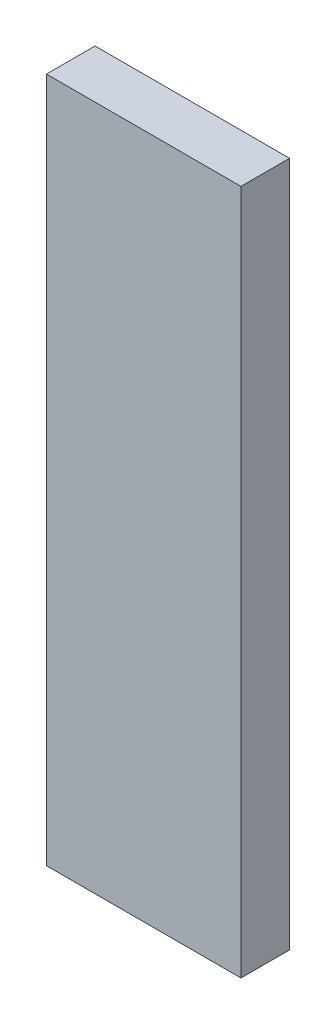
from build123d import *

# Parameters (mm, degrees)
SKETCH1_W           = 20
SKETCH1_H           = 70.5
BOSS_EXTRUDE1_DEPTH = 5


with BuildPart() as part:
    # Sketch1 → Boss-Extrude1 (new body)
    with BuildSketch(Plane.XY):
        with Locations((-90, 13.257283518)):
            Rectangle(SKETCH1_W, SKETCH1_H)
    extrude(amount=BOSS_EXTRUDE1_DEPTH)


solid = part.part
